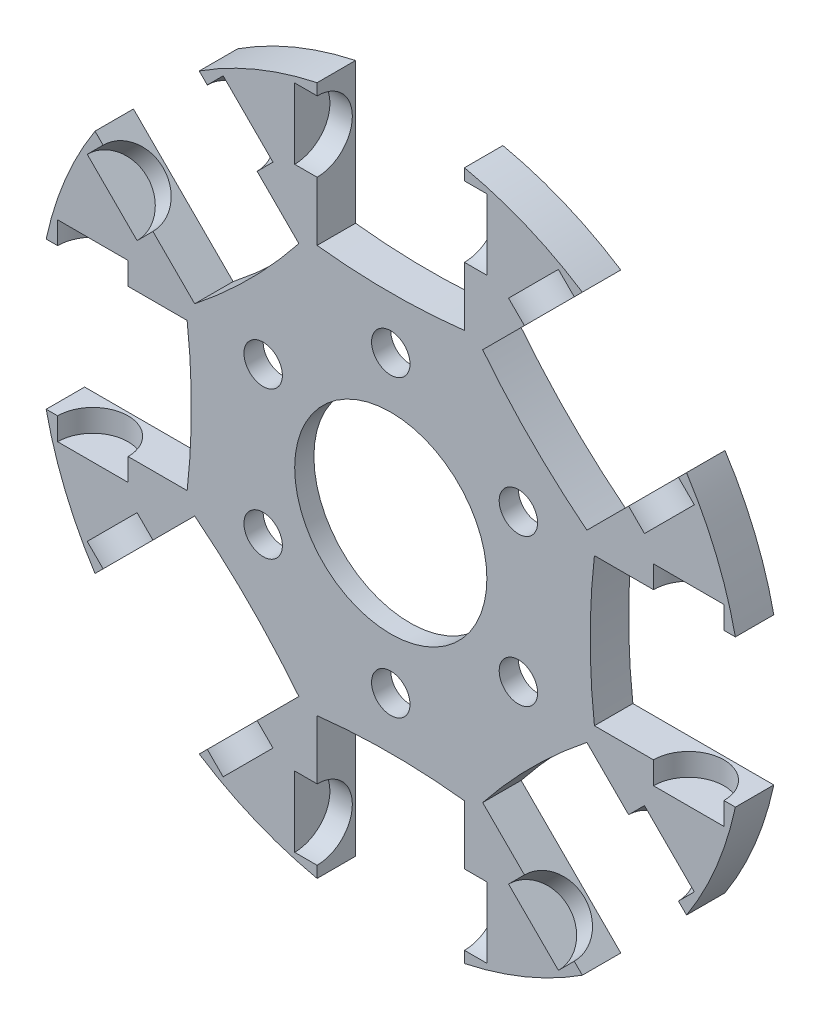
from build123d import *

# Parameters (mm, degrees)
SKETCH2_R           = 1.5
SKETCH2_R_2         = 7.5
BOSS_EXTRUDE2_DEPTH = 3
SKETCH2_4_R         = 14
SKETCH2_4_R_2       = 1.5
SKETCH2_4_R_3       = 7.5
BOSS_EXTRUDE3_DEPTH = 3
SKETCH3_W           = 15
SKETCH3_H           = 2.75
SKETCH5_R           = 15.5
CUT_EXTRUDE2_DEPTH  = 1.5
CIRPATTERN2_COUNT   = 8


with BuildPart() as part:
    # Sketch2 → Boss-Extrude2 (new body)
    with BuildSketch(Plane.XY):
        with BuildLine():
            Line((-5.75, 15.892145693), (-5.75, 26.892145693))
            ThreePointArc((-5.75, 26.892145693), (-10.52379439, 25.406687144), (-14.949754589, 23.081482572))
            Line((-14.949754589, 23.081482572), (-7.171579996, 15.303307979))
            ThreePointArc((-7.171579996, 15.303307979), (-11.002878695, 11.002878695), (-15.303307979, 7.171579996))
            Line((-15.303307979, 7.171579996), (-23.081482572, 14.949754589))
            ThreePointArc((-23.081482572, 14.949754589), (-25.406687144, 10.52379439), (-26.892145693, 5.75))
            Line((-26.892145693, 5.75), (-15.892145693, 5.75))
            ThreePointArc((-15.892145693, 5.75), (-15.560420276, 0), (-15.892145693, -5.75))
            Line((-15.892145693, -5.75), (-26.892145693, -5.75))
            ThreePointArc((-26.892145693, -5.75), (-25.406687144, -10.52379439), (-23.081482572, -14.949754589))
            Line((-23.081482572, -14.949754589), (-15.303307979, -7.171579996))
            ThreePointArc((-15.303307979, -7.171579996), (-11.002878695, -11.002878695), (-7.171579996, -15.303307979))
            Line((-7.171579996, -15.303307979), (-14.949754589, -23.081482572))
            ThreePointArc((-14.949754589, -23.081482572), (-10.52379439, -25.406687144), (-5.75, -26.892145693))
            Line((-5.75, -26.892145693), (-5.75, -15.892145693))
            ThreePointArc((-5.75, -15.892145693), (0, -15.560420276), (5.75, -15.892145693))
            Line((5.75, -15.892145693), (5.75, -26.892145693))
            ThreePointArc((5.75, -26.892145693), (10.52379439, -25.406687144), (14.949754589, -23.081482572))
            Line((14.949754589, -23.081482572), (7.171579996, -15.303307979))
            ThreePointArc((7.171579996, -15.303307979), (11.002878695, -11.002878695), (15.303307979, -7.171579996))
            Line((15.303307979, -7.171579996), (23.081482572, -14.949754589))
            ThreePointArc((23.081482572, -14.949754589), (25.406687144, -10.52379439), (26.892145693, -5.75))
            Line((26.892145693, -5.75), (15.892145693, -5.75))
            ThreePointArc((15.892145693, -5.75), (15.560420276, 0), (15.892145693, 5.75))
            Line((15.892145693, 5.75), (26.892145693, 5.75))
            ThreePointArc((26.892145693, 5.75), (25.406687144, 10.52379439), (23.081482572, 14.949754589))
            Line((23.081482572, 14.949754589), (15.303307979, 7.171579996))
            ThreePointArc((15.303307979, 7.171579996), (11.002878695, 11.002878695), (7.171579996, 15.303307979))
            Line((7.171579996, 15.303307979), (14.949754589, 23.081482572))
            ThreePointArc((14.949754589, 23.081482572), (10.52379439, 25.406687144), (5.75, 26.892145693))
            Line((5.75, 26.892145693), (5.75, 15.892145693))
            ThreePointArc((5.75, 15.892145693), (0, 15.560420276), (-5.75, 15.892145693))
        make_face()
        with Locations((0, 11.5)):
            Circle(SKETCH2_R, mode=Mode.SUBTRACT)
        with Locations((-9.959292144, -5.75)):
            Circle(SKETCH2_R, mode=Mode.SUBTRACT)
        with Locations((0, -11.5)):
            Circle(SKETCH2_R, mode=Mode.SUBTRACT)
        with Locations((9.959292144, -5.75)):
            Circle(SKETCH2_R, mode=Mode.SUBTRACT)
        with Locations((-9.959292144, 5.75)):
            Circle(SKETCH2_R, mode=Mode.SUBTRACT)
        Circle(SKETCH2_R_2, mode=Mode.SUBTRACT)
        with Locations((9.959292144, 5.75)):
            Circle(SKETCH2_R, mode=Mode.SUBTRACT)
    extrude(amount=BOSS_EXTRUDE2_DEPTH)

    # Sketch2<4> → Boss-Extrude3 (add)
    with BuildSketch(Plane.XY):
        Circle(SKETCH2_4_R)
        with Locations((-9.959292144, -5.75)):
            Circle(SKETCH2_4_R_2, mode=Mode.SUBTRACT)
        with Locations((0, -11.5)):
            Circle(SKETCH2_4_R_2, mode=Mode.SUBTRACT)
        with Locations((9.959292144, -5.75)):
            Circle(SKETCH2_4_R_2, mode=Mode.SUBTRACT)
        with Locations((-9.959292144, 5.75)):
            Circle(SKETCH2_4_R_2, mode=Mode.SUBTRACT)
        Circle(SKETCH2_4_R_3, mode=Mode.SUBTRACT)
        with Locations((9.959292144, 5.75)):
            Circle(SKETCH2_4_R_2, mode=Mode.SUBTRACT)
        with Locations((0, 11.5)):
            Circle(SKETCH2_4_R_2, mode=Mode.SUBTRACT)
    extrude(amount=BOSS_EXTRUDE3_DEPTH)

    # Sketch3 → Cut-Revolve1 (revolve, cut)
    with BuildSketch(Plane.XY.offset(3)):
        with Locations((0, 24.625)):
            Rectangle(SKETCH3_W, SKETCH3_H)
    cut_revolve1 = revolve(axis=Axis((7.5, 23.25, 3), (-1, 0, 0)), mode=Mode.SUBTRACT)

    # Sketch5 → Cut-Extrude2 (cut)
    with BuildSketch(Plane(origin=(0, 0, 0), x_dir=(-1, 0, 0), z_dir=(0, 0, -1))):
        Circle(SKETCH5_R)
    extrude(amount=-CUT_EXTRUDE2_DEPTH, mode=Mode.SUBTRACT)

    # CirPattern2: Cut-Revolve1 ×8 about axis
    cirpattern2_axis = Axis((0, 0, 3), (0, 0, 1))
    for i in range(1, CIRPATTERN2_COUNT):
        add(cut_revolve1.rotate(cirpattern2_axis, i * 360 / CIRPATTERN2_COUNT), mode=Mode.SUBTRACT)


solid = part.part
